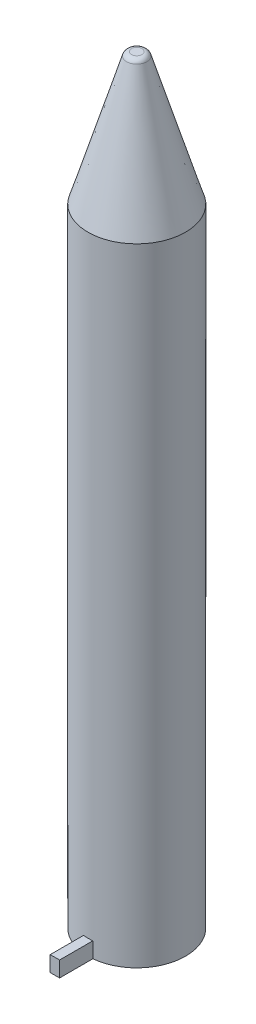
from build123d import *

# Parameters (mm, degrees)
SKETCH1_R           = 9.398
BOSS_EXTRUDE1_DEPTH = 120.65
BOSS_EXTRUDE2_DEPTH = 3
SKETCH4_R           = 2.5
CUT_EXTRUDE1_DEPTH  = 2.54


with BuildPart() as part:
    # Sketch1 → Boss-Extrude1 (new body)
    with BuildSketch(Plane(origin=(0, 0, 0), x_dir=(1, 0, 0), z_dir=(0, 1, 0))):
        Circle(SKETCH1_R)
    extrude(amount=BOSS_EXTRUDE1_DEPTH)

    # Sketch2 → Revolve1 (revolve)
    with BuildSketch(Plane.XY):
        with BuildLine():
            Line((0, 120.65), (0, 146.05))
            Line((0, 146.05), (1, 146.05))
            ThreePointArc((1, 146.05), (1.59642422, 145.85266939), (1.95746293, 145.338556299))
            Line((1.95746293, 145.338556299), (9.398, 120.65))
            Line((9.398, 120.65), (0, 120.65))
        make_face()
    revolve(axis=Axis((0, 120.65, 0), (0, 1, 0)))

    # Sketch3 → Boss-Extrude2 (add)
    with BuildSketch(Plane.XZ):
        with BuildLine():
            Line((-0.9, 15.75), (0.9, 15.75))
            Line((0.9, 15.75), (0.9, 9.354806465))
            ThreePointArc((0.9, 9.354806465), (0, 9.398), (-0.9, 9.354806465))
            Line((-0.9, 9.354806465), (-0.9, 15.75))
        make_face()
    extrude(amount=-BOSS_EXTRUDE2_DEPTH)

    # Sketch4 → Cut-Extrude1 (cut)
    with BuildSketch(Plane.XZ):
        Circle(SKETCH4_R)
    extrude(amount=-CUT_EXTRUDE1_DEPTH, mode=Mode.SUBTRACT)


solid = part.part
